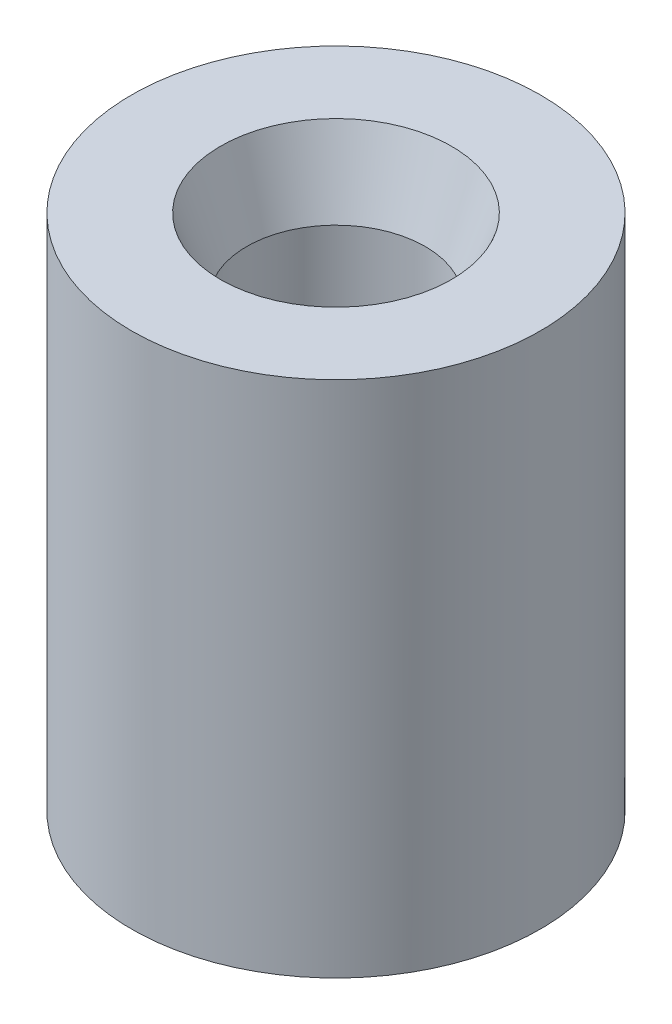
from build123d import *

# Parameters (mm, degrees)
SKETCH1_R           = 5.842
SKETCH1_R_2         = 3.302
BOSS_EXTRUDE1_DEPTH = 2.1082
BOSS_EXTRUDE2_START = 12.7
SKETCH4_R           = 5.842
SKETCH4_R_2         = 2.5527
BOSS_EXTRUDE2_DEPTH = 12.7


with BuildPart() as part:
    # Sketch1 → Boss-Extrude1 (new body)
    with BuildSketch(Plane(origin=(0, 0, 0), x_dir=(1, 0, 0), z_dir=(0, 1, 0))):
        Circle(SKETCH1_R)
        Circle(SKETCH1_R_2, mode=Mode.SUBTRACT)
    extrude(amount=BOSS_EXTRUDE1_DEPTH)

    # Sketch3 → Revolve1 (revolve)
    with BuildSketch(Plane.XY):
        Polygon((-3.302, 2.1082), (-2.5527, 0), (-3.302, 0), align=None)
    revolve(axis=Axis((0, 0, 0), (0, 1, 0)))

    # Sketch4 → Boss-Extrude2 (add)
    with BuildSketch(Plane.XZ.offset(BOSS_EXTRUDE2_START)):
        Circle(SKETCH4_R)
        Circle(SKETCH4_R_2, mode=Mode.SUBTRACT)
    extrude(amount=-BOSS_EXTRUDE2_DEPTH)


solid = part.part
